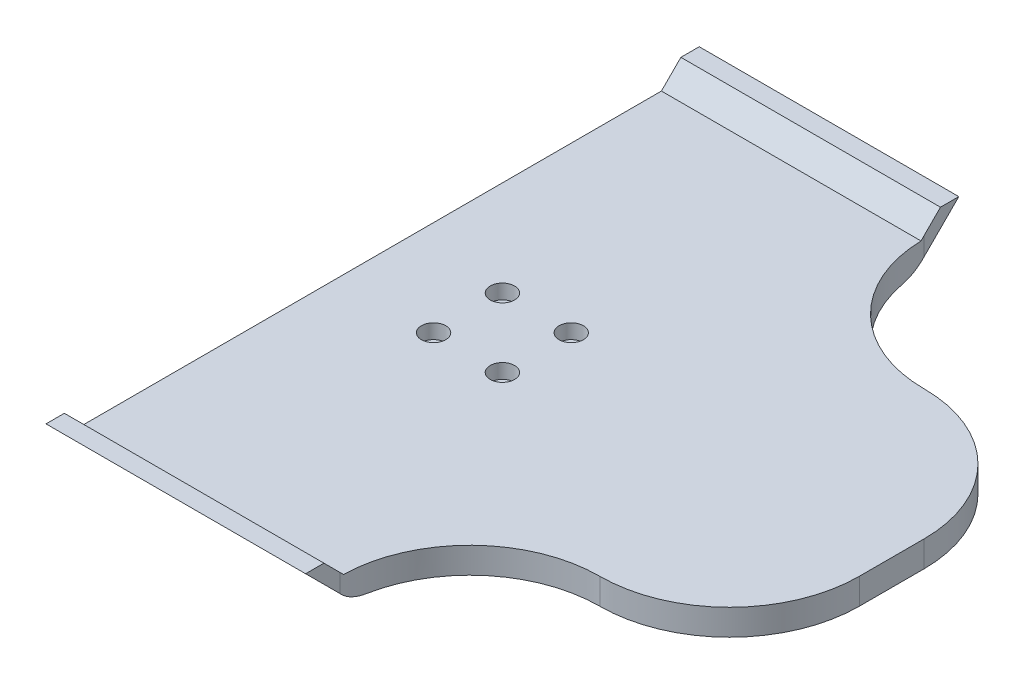
from build123d import *

# Parameters (mm, degrees)
MAIN_DEPTH          = 40
SKETCH11_W          = 100
SKETCH11_H          = 8
BOSS_EXTRUDE1_DEPTH = 80
FILLET1_R           = 40
SKETCH12_R          = 2.2
CUT_EXTRUDE1_DEPTH  = 162.365552125
SKETCH13_R          = 3.75
CUT_EXTRUDE2_DEPTH  = 4.5
CUT_EXTRUDE3_START  = 13
SKETCH14_W          = 80
SKETCH14_H          = 214.313708498
CUT_EXTRUDE3_DEPTH  = 7
CUT_EXTRUDE4_START  = 1
CUT_EXTRUDE4_DEPTH  = 135.291427387
FILLET2_R           = 10


with BuildPart() as part:
    # Sketch2 → Main (new, symmetric)
    with BuildSketch(Plane(origin=(0, 0, 0), x_dir=(0, 0, -1), z_dir=(1, 0, 0))):
        Polygon((-89, 0), (89, 0), (101.5, 12.5), (107.156854249, 6.843145751), (92.313708499, -8), (-92.313708499, -8), (-107.156854249, 6.843145751), (-101.5, 12.5), align=None)
    extrude(amount=MAIN_DEPTH, both=True)

    # Sketch11 → Boss-Extrude1 (add)
    with BuildSketch(Plane(origin=(40, 0, 0), x_dir=(0, 0, -1), z_dir=(1, 0, 0))):
        with Locations((0, -4)):
            Rectangle(SKETCH11_W, SKETCH11_H)
    extrude(amount=BOSS_EXTRUDE1_DEPTH)

    # Fillet1
    fillet1_edges = [part.edges().sort_by_distance(p)[0] for p in [
        (120, -4, -50),
        (40, -4, -50),
        (40, -4, 50),
        (120, -4, 50),
    ]]
    fillet(fillet1_edges, radius=FILLET1_R - 0.0001)  # a hair under: the kernel refuses the full size

    # Sketch12 → Cut-Extrude1 (cut, through all)
    with BuildSketch(Plane(origin=(0, 0, 0), x_dir=(1, 0, 0), z_dir=(0, 1, 0))):
        with Locations(Location((-10.606601718, 10.606601718, 0), (0, 0, 270))):
            Circle(SKETCH12_R)
        with Locations(Location((10.606601718, 10.606601718, 0), (0, 0, 270))):
            Circle(SKETCH12_R)
        with Locations(Location((10.606601718, -10.606601718, 0), (0, 0, 270))):
            Circle(SKETCH12_R)
        with Locations(Location((-10.606601718, -10.606601718, 0), (0, 0, 270))):
            Circle(SKETCH12_R)
    extrude(amount=-CUT_EXTRUDE1_DEPTH, mode=Mode.SUBTRACT)

    # Sketch13 → Cut-Extrude2 (cut)
    with BuildSketch(Plane(origin=(0, 0, 0), x_dir=(1, 0, 0), z_dir=(0, 1, 0))):
        with Locations(Location((-10.606601718, 10.606601718, 0), (0, 0, 270))):
            Circle(SKETCH13_R)
        with Locations(Location((10.606601718, 10.606601718, 0), (0, 0, 270))):
            Circle(SKETCH13_R)
        with Locations(Location((10.606601718, -10.606601718, 0), (0, 0, 270))):
            Circle(SKETCH13_R)
        with Locations(Location((-10.606601718, -10.606601718, 0), (0, 0, 270))):
            Circle(SKETCH13_R)
    extrude(amount=-CUT_EXTRUDE2_DEPTH, mode=Mode.SUBTRACT)

    # Sketch14 → Cut-Extrude3 (cut)
    with BuildSketch(Plane(origin=(0, 0, 0), x_dir=(1, 0, 0), z_dir=(0, 1, 0)).offset(CUT_EXTRUDE3_START)):
        Rectangle(SKETCH14_W, SKETCH14_H)
    extrude(amount=-CUT_EXTRUDE3_DEPTH, mode=Mode.SUBTRACT)

    # Sketch15 → Cut-Extrude4 (cut, through all)
    with BuildSketch(Plane(origin=(40, 0, 0), x_dir=(0, 0, -1), z_dir=(1, 0, 0)).offset(CUT_EXTRUDE4_START)):
        Polygon((106.313708499, 6), (92.313708499, -8), (86.656854249, -8), (100.656854249, 6), align=None)
    cut_extrude4 = extrude(amount=-CUT_EXTRUDE4_DEPTH, mode=Mode.SUBTRACT)

    # Mirror1: Cut-Extrude4 across plane
    add(cut_extrude4.mirror(Plane.XY), mode=Mode.SUBTRACT)

    # Fillet2
    fillet2_edges = [part.edges().sort_by_distance(p)[0] for p in [
        (0.069972296, -8, 86.656854249),
        (0.069972296, -8, -86.656854249),
    ]]
    fillet(fillet2_edges, radius=FILLET2_R)


solid = part.part
